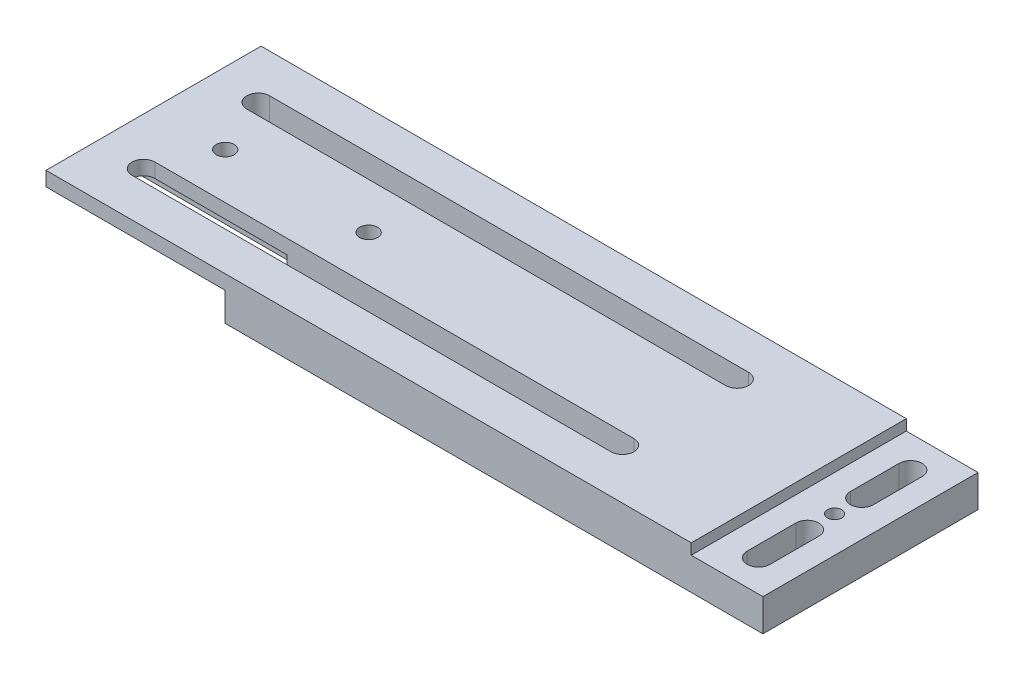
from build123d import *

# Parameters (mm, degrees)
SKIZZE1_W                       = 100
SKIZZE1_H                       = 30
AUFSATZ_LINEAR_AUSTRAGEN1_DEPTH = 6
DURCHGANGSLOCH_F_R_M31_DEPTH    = 6
DURCHGANGSLOCH_F_R_M32_DEPTH    = 6
M3_GEWINDEBOHRUNG1_D            = 2.5
SKIZZE12_W                      = 12
SKIZZE12_H                      = 4
SCHNITT_LINEAR_AUSTRAGEN1_DEPTH = 25
VERRUNDUNG1_R                   = 2.5
SKIZZE13_W                      = 10
SKIZZE13_H                      = 30
SCHNITT_LINEAR_AUSTRAGEN2_DEPTH = 1.5
F_2_0MM_STIFTLOCH1_D            = 2
F_2_0MM_STIFTLOCH1_DEPTH        = 8.5
F_2_0MM_STIFTLOCH1_TIP          = 0.600860619


# Read off the part's stored shape, not the designer's step: Durchgangsloch für M31, Durchgangsloch für M32
with BuildPart() as part:
    # Skizze1 → Aufsatz-Linear austragen1 (new body)
    with BuildSketch(Plane(origin=(0, 0, 0), x_dir=(1, 0, 0), z_dir=(0, 1, 0))):
        Rectangle(SKIZZE1_W, SKIZZE1_H)
    extrude(amount=AUFSATZ_LINEAR_AUSTRAGEN1_DEPTH)

    # Durchgangsloch für M31 outline → Durchgangsloch für M31 (cut)
    with BuildSketch(Plane(origin=(0, 0, 0), x_dir=(1, 0, 0), z_dir=(0, 1, 0))):
        with BuildLine():
            Line((-43.4, -9.6), (23.4, -9.6))
            ThreePointArc((23.4, -9.6), (25, -8), (23.4, -6.4))
            Line((23.4, -6.4), (-43.4, -6.4))
            ThreePointArc((-43.4, -6.4), (-45, -8), (-43.4, -9.6))
        make_face()
        with BuildLine():
            Line((-43.4, 6.4), (23.4, 6.4))
            ThreePointArc((23.4, 6.4), (25, 8), (23.4, 9.6))
            Line((23.4, 9.6), (-43.4, 9.6))
            ThreePointArc((-43.4, 9.6), (-45, 8), (-43.4, 6.4))
        make_face()
    extrude(amount=DURCHGANGSLOCH_F_R_M31_DEPTH, mode=Mode.SUBTRACT)

    # Durchgangsloch für M32 outline → Durchgangsloch für M32 (cut)
    with BuildSketch(Plane(origin=(0, 0, 0), x_dir=(1, 0, 0), z_dir=(0, 1, 0))):
        with BuildLine():
            ThreePointArc((46.6, 10.605062793), (45, 12.205062793), (43.4, 10.605062793))
            Line((43.4, 10.605062793), (43.4, 3.805062793))
            ThreePointArc((43.4, 3.805062793), (45, 2.205062793), (46.6, 3.805062793))
            Line((46.6, 3.805062793), (46.6, 10.605062793))
        make_face()
        with BuildLine():
            Line((46.6, -10.605062793), (46.6, -3.805062793))
            ThreePointArc((46.6, -3.805062793), (45, -2.205062793), (43.4, -3.805062793))
            Line((43.4, -3.805062793), (43.4, -10.605062793))
            ThreePointArc((43.4, -10.605062793), (45, -12.205062793), (46.6, -10.605062793))
        make_face()
    extrude(amount=DURCHGANGSLOCH_F_R_M32_DEPTH, mode=Mode.SUBTRACT)

    # M3 Gewindebohrung1 (through all)
    with Locations(Plane(origin=(0, 6, 0), x_dir=(1, 0, 0), z_dir=(0, 1, 0))):
        with Locations((-40, 0), (-20, 0)):
            Hole(M3_GEWINDEBOHRUNG1_D / 2)

    # Skizze12 → Schnitt-Linear austragen1 (cut)
    with BuildSketch(Plane.ZY.offset(50)):
        with Locations((9, 2)):
            Rectangle(SKIZZE12_W, SKIZZE12_H)
    extrude(amount=-SCHNITT_LINEAR_AUSTRAGEN1_DEPTH, mode=Mode.SUBTRACT)

    # Verrundung1
    verrundung1_edges = [part.edges().sort_by_distance(p)[0] for p in [
        (-25, 2, 3),
    ]]
    fillet(verrundung1_edges, radius=VERRUNDUNG1_R)

    # Skizze13 → Schnitt-Linear austragen2 (cut)
    with BuildSketch(Plane(origin=(0, 6, 0), x_dir=(1, 0, 0), z_dir=(0, 1, 0))):
        with Locations((45, 0)):
            Rectangle(SKIZZE13_W, SKIZZE13_H)
    extrude(amount=-SCHNITT_LINEAR_AUSTRAGEN2_DEPTH, mode=Mode.SUBTRACT)

    # Ø2.0mm Stiftloch1
    with Locations(Plane(origin=(0, 4.5, 0), x_dir=(1, 0, 0), z_dir=(0, 1, 0))):
        with Locations((45, 0)):
            Hole(F_2_0MM_STIFTLOCH1_D / 2, depth=F_2_0MM_STIFTLOCH1_DEPTH)
            with Locations((0, 0, -(F_2_0MM_STIFTLOCH1_DEPTH + F_2_0MM_STIFTLOCH1_TIP / 2))):  # 118° drill point
                Cone(0, F_2_0MM_STIFTLOCH1_D / 2, F_2_0MM_STIFTLOCH1_TIP, mode=Mode.SUBTRACT)


solid = part.part
